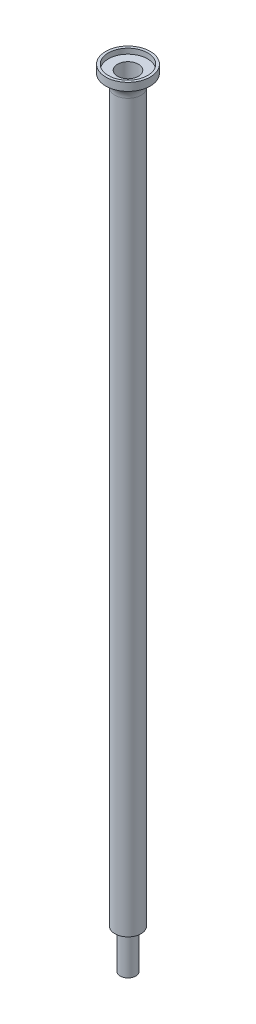
from build123d import *

# Parameters (mm, degrees)
SHELL1_T           = -1
SKETCH2_R          = 2
CUT_EXTRUDE1_DEPTH = 300.241541234
FILLET1_R          = 5


with BuildPart() as part:
    # Sketch1 → Revolve1 (revolve)
    with BuildSketch(Plane(origin=(0, 0, 0), x_dir=(0, 0, -1), z_dir=(1, 0, 0)), mode=Mode.PRIVATE) as revolve1_sk:
        Polygon((0, 64.190330059), (8.5, 64.190330059), (8.5, 61.190330059), (5, 61.190330059), (5, -220.809669941), (3, -220.809669941), (3, -235.809669941), (0, -235.809669941), align=None)
    revolve(revolve1_sk.sketch.rotate(Axis((0, 68.843964237, 0), (0, -1, 0)), 180), axis=Axis((0, 68.843964237, 0), (0, -1, 0)))

    # Shell1
    shell1_openings = [part.faces().sort_by_distance(p)[0] for p in [
        (0, 64.190330059, 0),
    ]]
    offset(amount=SHELL1_T, openings=shell1_openings, kind=Kind.INTERSECTION)

    # Sketch2 → Cut-Extrude1 (cut, through all)
    with BuildSketch(Plane(origin=(0, -234.809669941, 0), x_dir=(1, 0, 0), z_dir=(0, 1, 0))):
        with Locations(Location((0, 0, 0), (0, 0, 270))):
            Circle(SKETCH2_R)
    extrude(amount=-CUT_EXTRUDE1_DEPTH, mode=Mode.SUBTRACT)

    # Fillet1
    # the kernel refuses this fillet: 5 mm, written as the material it adds along each edge
    with BuildSketch(Plane(origin=(0, 61.190330059, 0), x_dir=(0, 0, 1), z_dir=(1, 0, 0))) as fillet1_piece_1:
        with BuildLine():
            CenterArc((10, 4.769696007), FILLET1_R, 180, 72.542396876)
            Line((5, 4.769696007), (4.9, 4.769696007))
            Line((4.9, 4.769696007), (4.9, 0))
            Line((4.9, 0), (5, -0.1))
            ThreePointArc((5, -0.1), (6.75, -0.1), (8.47, -0.09539392))
            Line((8.47, -0.09539392), (8.5, 0))
        make_face()
    revolve(axis=Axis((0, 61.190330059, 0), (0, -1, 0)))


solid = part.part
